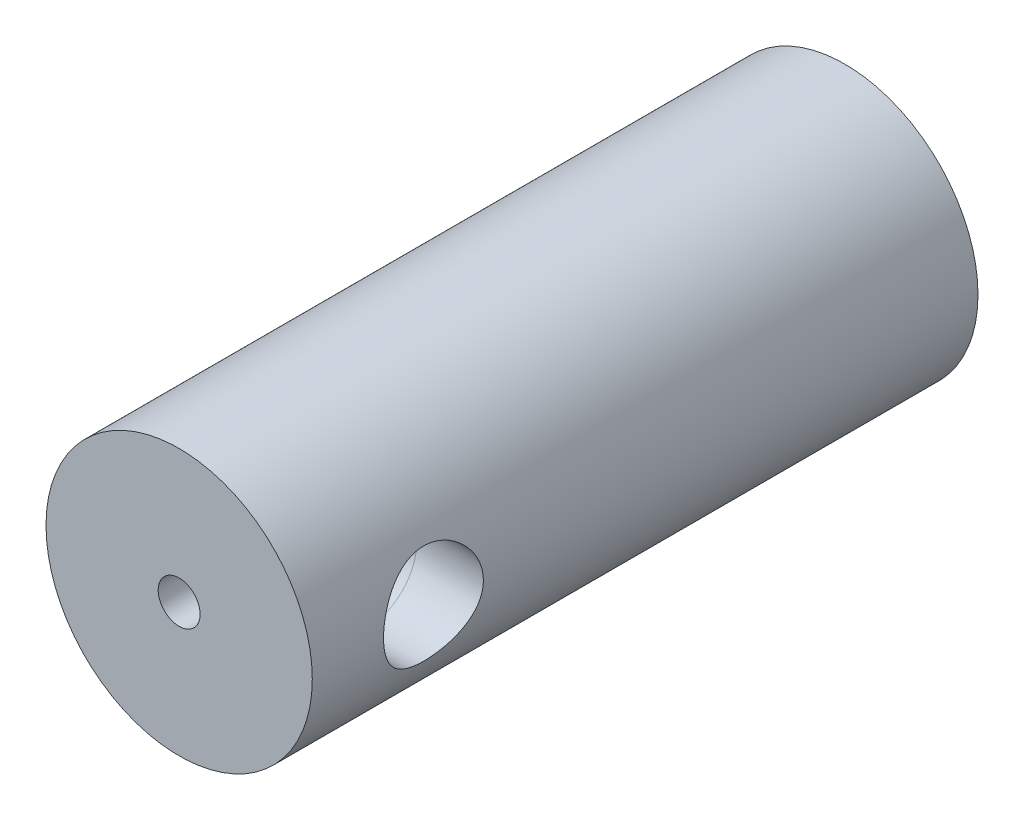
from build123d import *

# Parameters (mm, degrees)
SKETCH1_R           = 20
BOSS_EXTRUDE1_DEPTH = 100
SKETCH3_R           = 3.15
CUT_EXTRUDE2_DEPTH  = 5
SKETCH2_R           = 7.5


with BuildPart() as part:
    # Sketch1 → Boss-Extrude1 (new body)
    with BuildSketch(Plane.XY):
        Circle(SKETCH1_R)
    extrude(amount=BOSS_EXTRUDE1_DEPTH)

    # Sketch3 → Cut-Extrude2 (cut)
    with BuildSketch(Plane.XY.offset(100)):
        Circle(SKETCH3_R)
    extrude(amount=-CUT_EXTRUDE2_DEPTH, mode=Mode.SUBTRACT)

    # Cut-Sweep1: sweep along a path in Sketch4
    with BuildLine(Plane(origin=(0, 0, 0), x_dir=(1, 0, 0), z_dir=(0, 1, 0))) as cut_sweep1_path:
        Line((0, 0), (0, -71.793883449))
        ThreePointArc((0, -71.793883449), (2.928932188, -78.864951261), (10, -81.793883449))
        Line((10, -81.793883449), (20, -81.793883449))
    # Sketch2 → Cut-Sweep1 (sweep, cut)
    with BuildSketch(Plane(origin=(0, 0, 0), x_dir=(-1, 0, 0), z_dir=(0, 0, -1))):
        Circle(SKETCH2_R)
    sweep(path=cut_sweep1_path.line, mode=Mode.SUBTRACT)


solid = part.part
